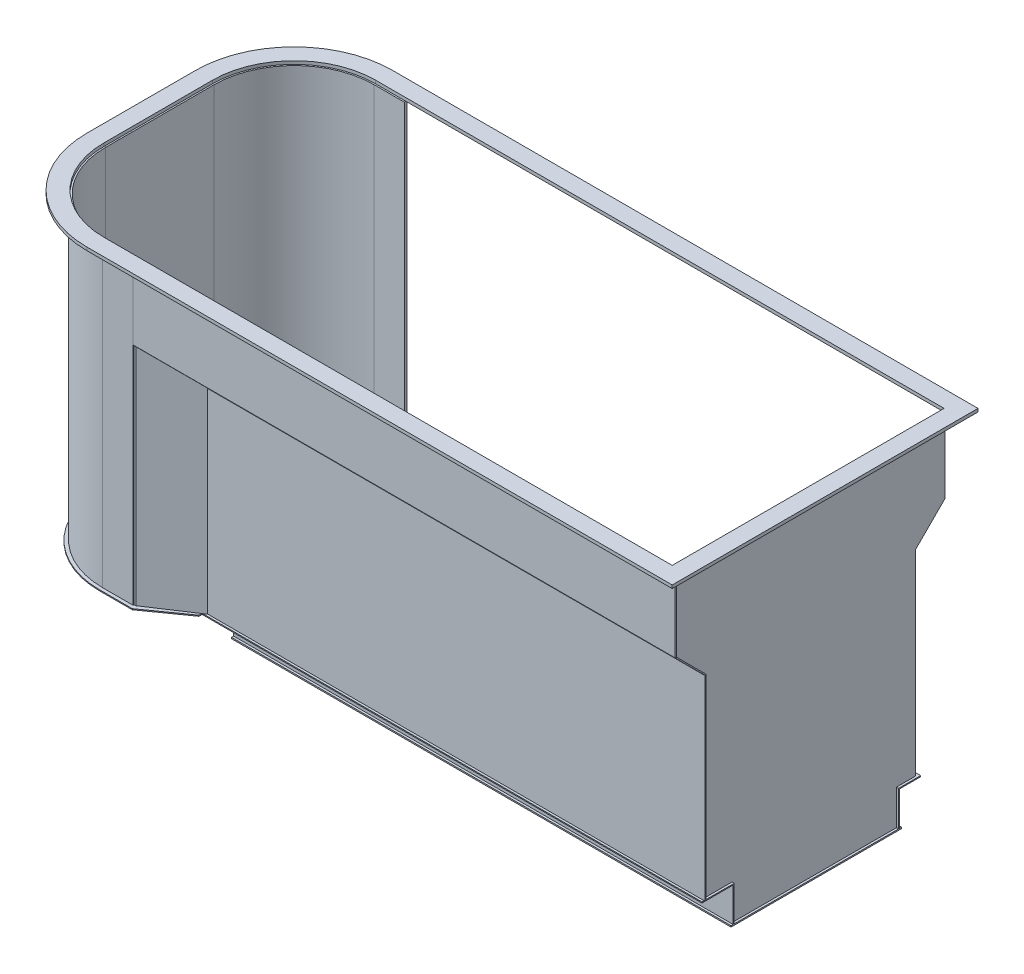
from build123d import *

# Parameters (mm, degrees)
SKETCH2_W                = 3950
SKETCH2_H                = 1350
BOTTOM_10_MM_DEPTH       = 10
BEND_BOTTOM_8_MM_DEPTH   = 3950
BACK_8_MM_DEPTH          = 8
CURB_25_DEPTH            = 25
FRONT_ROUND_DEPTH        = 2372
BEND_BOTTOM_8_MM_2_DEPTH = 8
SKETCH8_W                = 8
SKETCH8_H                = 1300
BOTTOM_LOWER_DEPTH       = 270
SKETCH9_W                = 4287
SKETCH9_H                = 587
HV_UPPER_DEPTH           = 10
SKETCH10_W               = 4287
SKETCH10_H               = 332
HV_MID_DEPTH             = 8
SKETCH11_W               = 3933
SKETCH11_H               = 1544.583694397
HV_LOWER_DEPTH           = 8
TEDA_WALA_HV_LV_DEPTH    = 1785


with BuildPart() as part:
    # Sketch2 → bottom 10 mm (new body)
    with BuildSketch(Plane(origin=(0, 0, 0), x_dir=(1, 0, 0), z_dir=(0, 1, 0))):
        with Locations((0, -20)):
            Rectangle(SKETCH2_W, SKETCH2_H)
    extrude(amount=BOTTOM_10_MM_DEPTH)

    # Sketch3 → bend bottom 8 mm (add)
    with BuildSketch(Plane(origin=(1975, 0, 0), x_dir=(0, 0, -1), z_dir=(1, 0, 0))):
        Polygon((-670, 10), (-670, 288), (-925, 288), (-925, 280), (-678, 280), (-678, 10), align=None)
        Polygon((630, 10), (630, 288), (805, 288), (805, 280), (638, 280), (638, 10), align=None)
    extrude(amount=-BEND_BOTTOM_8_MM_DEPTH)

    # Sketch4 → back 8 mm (add)
    with BuildSketch(Plane(origin=(1950, 0, 0), x_dir=(0, 0, -1), z_dir=(1, 0, 0))):
        Polygon((-1135, 2685), (1015, 2685), (1015, 2073), (780, 1838), (780, 288), (630, 288), (630, 10), (-670, 10), (-670, 288), (-900, 288), (-900, 1838), (-1135, 2073), align=None)
    extrude(amount=BACK_8_MM_DEPTH)

    # Sketch5 → CURB 25 (add)
    with BuildSketch(Plane(origin=(0, 2685, 0), x_dir=(1, 0, 0), z_dir=(0, 1, 0))):
        with BuildLine():
            Line((-2545, 1149), (2084, 1149))
            Line((2084, 1149), (2084, -1269))
            Line((2084, -1269), (-2545, -1269))
            ThreePointArc((-2545, -1269), (-3095.836182544, -1040.836182544), (-3324, -490))
            Line((-3324, -490), (-3324, 370))
            ThreePointArc((-3324, 370), (-3095.836182544, 920.836182544), (-2545, 1149))
        make_face()
        with BuildLine():
            Line((-2545, 1015), (1950, 1015))
            Line((1950, 1015), (1950, -1135))
            Line((1950, -1135), (-2545, -1135))
            ThreePointArc((-2545, -1135), (-3001.083873865, -946.083873865), (-3190, -490))
            Line((-3190, -490), (-3190, 370))
            ThreePointArc((-3190, 370), (-3001.083873865, 826.083873865), (-2545, 1015))
        make_face(mode=Mode.SUBTRACT)
    extrude(amount=-CURB_25_DEPTH)

    # Sketch6 → front round (add)
    with BuildSketch(Plane(origin=(0, 2660, 0), x_dir=(-1, 0, 0), z_dir=(0, -1, 0))):
        with BuildLine():
            Line((2306, 1015), (2545, 1015))
            ThreePointArc((2545, 1015), (3001.083873865, 826.083873865), (3190, 370))
            Line((3190, 370), (3190, -490))
            ThreePointArc((3190, -490), (3001.083873865, -946.083873865), (2545, -1135))
            Line((2545, -1135), (2306, -1135))
            Line((2306, -1135), (2306, -1123))
            Line((2306, -1123), (2545, -1123))
            ThreePointArc((2545, -1123), (2992.598592491, -937.598592491), (3178, -490))
            Line((3178, -490), (3178, 370))
            ThreePointArc((3178, 370), (2992.598592491, 817.598592491), (2545, 1003))
            Line((2545, 1003), (2306, 1003))
            Line((2306, 1003), (2306, 1015))
        make_face()
        with BuildLine():
            Line((2306, -1143), (2545, -1143))
            ThreePointArc((2545, -1143), (3006.740728115, -951.740728115), (3198, -490))
            Line((3198, -490), (3198, 370))
            ThreePointArc((3198, 370), (3006.740728115, 831.740728115), (2545, 1023))
            Line((2545, 1023), (2306, 1023))
            Line((2306, 1023), (2306, 1011))
            Line((2306, 1011), (2545, 1011))
            ThreePointArc((2545, 1011), (2998.255446741, 823.255446741), (3186, 370))
            Line((3186, 370), (3186, -490))
            ThreePointArc((3186, -490), (2998.255446741, -943.255446741), (2545, -1131))
            Line((2545, -1131), (2306, -1131))
            Line((2306, -1131), (2306, -1143))
        make_face()
    extrude(amount=FRONT_ROUND_DEPTH)

    # Sketch7 → bend bottom 8 mm 2 (add)
    with BuildSketch(Plane.XZ.offset(-288)):
        with BuildLine():
            Line((-2545, -1049), (-2317.859574468, -1049))
            Line((-2317.859574468, -1049), (-1977, -807))
            Line((-1977, -807), (-1977, -628))
            Line((-1977, -628), (-1950, -628))
            Line((-1950, -628), (-1950, 668))
            Line((-1950, 668), (-1977, 668))
            Line((-1977, 668), (-1977, 950))
            Line((-1977, 950), (-2285.463829787, 1169))
            Line((-2285.463829787, 1169), (-2545, 1169))
            ThreePointArc((-2545, 1169), (-3025.125504426, 970.125504426), (-3224, 490))
            Line((-3224, 490), (-3224, -370))
            ThreePointArc((-3224, -370), (-3025.125504426, -850.125504426), (-2545, -1049))
        make_face()
    extrude(amount=BEND_BOTTOM_8_MM_2_DEPTH)

    # Sketch8 → bottom lower (add)
    with BuildSketch(Plane.XZ.offset(-280)):
        with Locations((-1954, 20)):
            Rectangle(SKETCH8_W, SKETCH8_H)
    extrude(amount=BOTTOM_LOWER_DEPTH)


with BuildPart() as body_2:
    # Sketch9 → hv upper (new body)
    with BuildSketch(Plane.XY.offset(1135)):
        with Locations((-160.5, 2366.5)):
            Rectangle(SKETCH9_W, SKETCH9_H)
    extrude(amount=HV_UPPER_DEPTH)


with BuildPart() as body_3:
    # Sketch10 → hv mid (new body)
    with BuildSketch(Plane(origin=(0, 469, -469), x_dir=(1, 0, 0), z_dir=(0, -0.7071067811865479, 0.7071067811865472))):
        with Locations((-160.5, 2102.398554046)):
            Rectangle(SKETCH10_W, SKETCH10_H)
    extrude(amount=HV_MID_DEPTH)


with BuildPart() as body_4:
    # Sketch11 → HV lower (new body)
    with BuildSketch(Plane.XY.offset(900)):
        with Locations((16.5, 1060.291847198)):
            Rectangle(SKETCH11_W, SKETCH11_H)
    extrude(amount=HV_LOWER_DEPTH)


with BuildPart() as body_5:
    # Sketch12 → teda wala hv lv (new body)
    with BuildSketch(Plane(origin=(0, 288, 0), x_dir=(1, 0, 0), z_dir=(0, 1, 0))):
        Polygon((-2306, -1135), (-1950, -900.240548646), (-1950, -909.82338901), (-2291.468141326, -1135), align=None)
    extrude(amount=TEDA_WALA_HV_LV_DEPTH)


solid = Compound([part.part, body_2.part, body_3.part, body_4.part, body_5.part])
